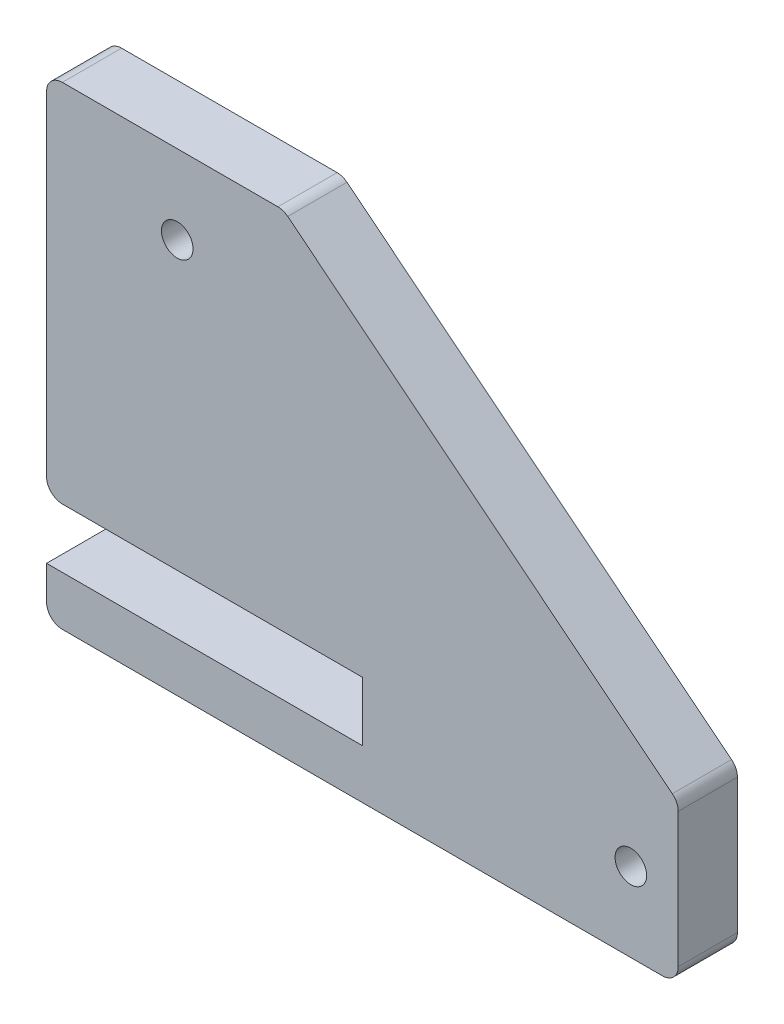
from build123d import *

# Parameters (mm, degrees)
BOSS_EXTRUDE1_DEPTH = 2.38125
SKETCH2_R           = 1.27
CUT_EXTRUDE1_DEPTH  = 41.937805342
SKETCH3_R           = 1.27
CUT_EXTRUDE2_DEPTH  = 41.937805342
CUT_EXTRUDE3_DEPTH  = 41.937805342
FILLET1_R           = 1.27


with BuildPart() as part:
    # Sketch1 → Boss-Extrude1 (new, symmetric)
    with BuildSketch(Plane.XY):
        Polygon((-25.4, 2.38125), (0, 2.38125), (0, -2.38125), (-25.4, -2.38125), (-25.4, -6.35), (25.4, -6.35), (25.4, 31.75), (-25.4, 31.75), align=None)
    extrude(amount=BOSS_EXTRUDE1_DEPTH, both=True)

    # Sketch2 → Cut-Extrude1 (cut, through all)
    with BuildSketch(Plane.XY.offset(2.38125)):
        with Locations((21.59, 0)):
            Circle(SKETCH2_R)
    extrude(amount=-CUT_EXTRUDE1_DEPTH, mode=Mode.SUBTRACT)

    # Sketch3 → Cut-Extrude2 (cut, through all)
    with BuildSketch(Plane.XY.offset(2.38125)):
        with Locations((-14.887972806, 25.4)):
            Circle(SKETCH3_R)
    extrude(amount=-CUT_EXTRUDE2_DEPTH, mode=Mode.SUBTRACT)

    # Sketch4 → Cut-Extrude3 (cut, through all)
    with BuildSketch(Plane.XY.offset(2.38125)):
        Polygon((-6.35, 31.75), (25.4, 6.35), (25.4, 31.75), align=None)
    extrude(amount=-CUT_EXTRUDE3_DEPTH, mode=Mode.SUBTRACT)

    # Fillet1
    fillet1_edges = [part.edges().sort_by_distance(p)[0] for p in [
        (-25.4, -6.35, 0),
        (25.4, -6.35, 0),
        (-25.4, 2.38125, 0),
        (-25.4, 31.75, 0),
        (25.4, 6.35, 0),
        (-6.35, 31.75, 0),
    ]]
    fillet(fillet1_edges, radius=FILLET1_R)


solid = part.part
